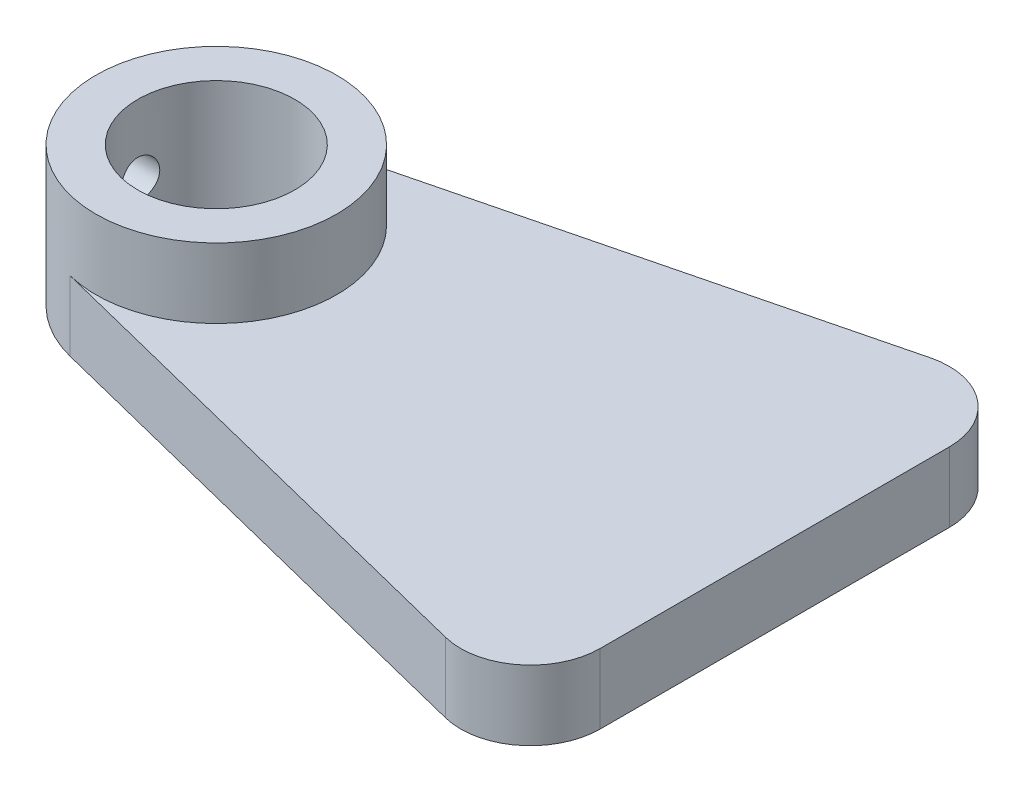
from build123d import *

# Parameters (mm, degrees)
SKETCH1_R           = 5.625
BOSS_EXTRUDE1_DEPTH = 5
SKETCH1_3_R         = 5.625
BOSS_EXTRUDE2_DEPTH = 10
SKETCH2_R           = 1.4
CUT_EXTRUDE1_DEPTH  = 45.791182168


with BuildPart() as part:
    # Sketch1 → Boss-Extrude1 (new body)
    with BuildSketch(Plane(origin=(0, 0, 0), x_dir=(1, 0, 0), z_dir=(0, 1, 0))):
        with BuildLine():
            Line((33.785612553, 17.35028485), (-2.094818345, 8.366741367))
            ThreePointArc((-2.094818345, 8.366741367), (-8.625, 0), (-2.094818345, -8.366741367))
            Line((-2.094818345, -8.366741367), (33.785612553, -17.35028485))
            ThreePointArc((33.785612553, -17.35028485), (38.076366588, -16.441569309), (40, -12.5))
            Line((40, -12.5), (40, 12.5))
            ThreePointArc((40, 12.5), (38.076366588, 16.441569309), (33.785612553, 17.35028485))
        make_face()
        Circle(SKETCH1_R, mode=Mode.SUBTRACT)
    extrude(amount=BOSS_EXTRUDE1_DEPTH)

    # Sketch1<3> → Boss-Extrude2 (add)
    with BuildSketch(Plane(origin=(0, 0, 0), x_dir=(1, 0, 0), z_dir=(0, 1, 0))):
        with BuildLine():
            ThreePointArc((8.625, 0), (5.306732364, 6.799207058), (-2.094818345, 8.366741367))
            ThreePointArc((-2.094818345, 8.366741367), (-8.625, 0), (-2.094818345, -8.366741367))
            ThreePointArc((-2.094818345, -8.366741367), (5.306732364, -6.799207058), (8.625, 0))
        make_face()
        Circle(SKETCH1_3_R, mode=Mode.SUBTRACT)
    extrude(amount=BOSS_EXTRUDE2_DEPTH)

    # Sketch2 → Cut-Extrude1 (cut, through all)
    with BuildSketch(Plane(origin=(0, 0, 0), x_dir=(0, 0, -1), z_dir=(1, 0, 0))):
        with Locations((0, 5)):
            Circle(SKETCH2_R)
    extrude(amount=-CUT_EXTRUDE1_DEPTH, mode=Mode.SUBTRACT)


solid = part.part
